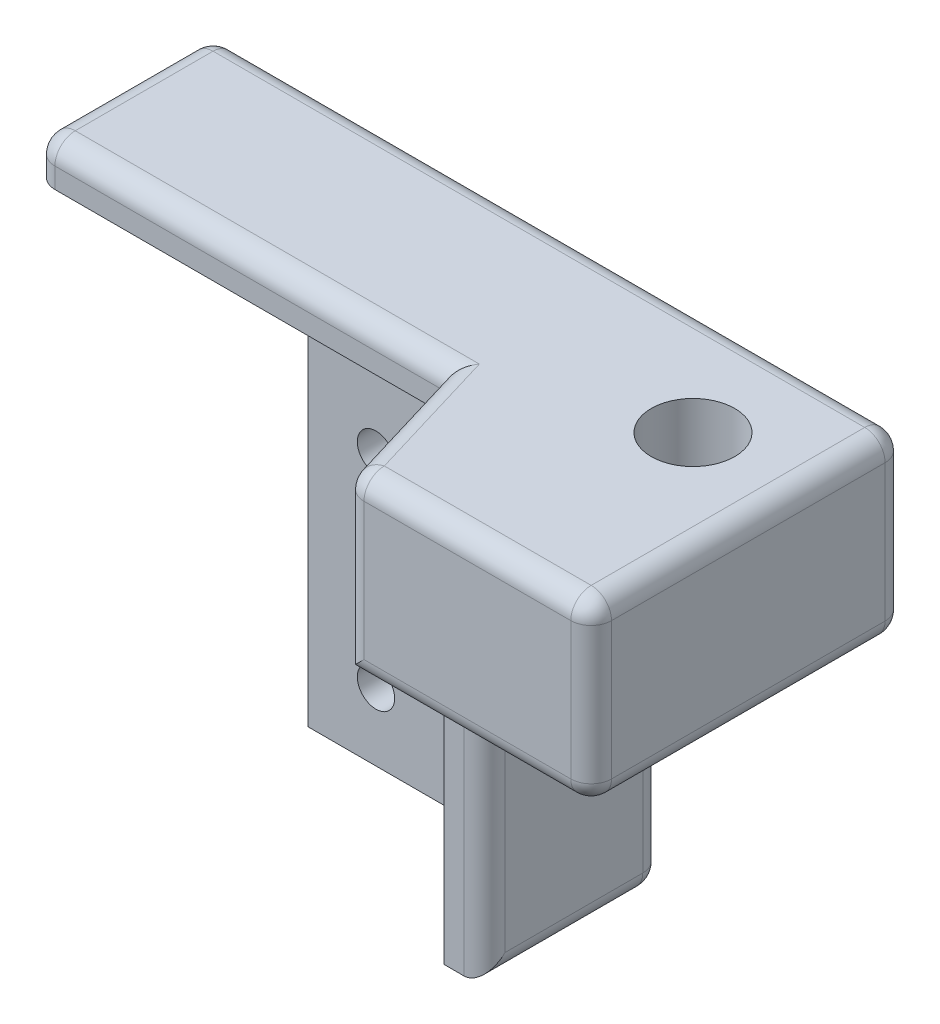
from build123d import *

# Parameters (mm, degrees)
SKETCH1_W                            = 102
SKETCH1_H                            = 26.3
SKETCH1_R                            = 6.15
BASE_DEPTH                           = 20.2
BACKSIDE_SURFACE_1_REACH             = 109.255
SKETCH2_W                            = 60.3
SKETCH2_H                            = 20.3
BACKSIDE_SURFACE_1_DIRECTION_2_DEPTH = 108.255442752
SKETCH4_W                            = 6
SKETCH4_H                            = 26.3
LEG_DEPTH                            = 50
SKETCH5_W                            = 26.3
SKETCH5_H                            = 6
ROOF_DEPTH                           = 102
SKETCH6_R                            = 6.15
HOLE_FOR_LINEAR_ROD_DEPTH            = 26.2
SKETCH9_W                            = 35.7
SKETCH9_H                            = 20
BOSS_EXTRUDE5_DEPTH                  = 26.2
SKETCH7_W                            = 40.3
SKETCH7_H                            = 50
BACKSIDE_SURFACE_2_DEPTH             = 6
BOLT_HOLES_REACH                     = 124.669
SKETCH3_R                            = 2.75
CHAMFER1_SIZE                        = 6
CHAMFER1_SIZE_2                      = 20
FILLET1_R                            = 3


with BuildPart() as part:
    # Sketch1 → base (new body)
    with BuildSketch(Plane(origin=(0, 0, 0), x_dir=(1, 0, 0), z_dir=(0, 1, 0))):
        with Locations((51, 13.15)):
            Rectangle(SKETCH1_W, SKETCH1_H)
        with Locations(Location((87, 10, 0), (0, 0, 270))):
            Circle(SKETCH1_R, mode=Mode.SUBTRACT)
    extrude(amount=BASE_DEPTH)

    # Sketch2 → backside surface 1 (cut, up to next)
    with BuildSketch(Plane(origin=(0, 20.2, 0), x_dir=(1, 0, 0), z_dir=(0, 1, 0)), mode=Mode.PRIVATE) as backside_surface_1_sk1:
        with Locations((30.15, 10.15)):
            Rectangle(SKETCH2_W, SKETCH2_H)
    backside_surface_1_tool1 = extrude(backside_surface_1_sk1.sketch, amount=-BACKSIDE_SURFACE_1_REACH, mode=Mode.PRIVATE) & part.part
    add(backside_surface_1_tool1.solids().sort_by_distance((30.15, 20.2, -10.15))[0], mode=Mode.SUBTRACT)

    # Sketch2 → backside surface 1 direction 2 (cut)
    with BuildSketch(Plane(origin=(0, 20.2, 0), x_dir=(1, 0, 0), z_dir=(0, 1, 0))):
        with Locations((30.15, 10.15)):
            Rectangle(SKETCH2_W, SKETCH2_H)
    extrude(amount=BACKSIDE_SURFACE_1_DIRECTION_2_DEPTH, mode=Mode.SUBTRACT)

    # Sketch4 → leg (add)
    with BuildSketch(Plane(origin=(0, 0, 0), x_dir=(1, 0, 0), z_dir=(0, 1, 0))):
        with Locations((63.3, 13.15)):
            Rectangle(SKETCH4_W, SKETCH4_H)
    extrude(amount=-LEG_DEPTH)

    # Sketch5 → roof (add)
    with BuildSketch(Plane.ZY):
        with Locations((-13.15, 23.2)):
            Rectangle(SKETCH5_W, SKETCH5_H)
    extrude(amount=-ROOF_DEPTH)

    # Sketch6 → hole for linear rod (cut)
    with BuildSketch(Plane.XZ):
        with Locations(Location((87, -10, 0), (0, 0, 90))):
            Circle(SKETCH6_R)
    extrude(amount=-HOLE_FOR_LINEAR_ROD_DEPTH, mode=Mode.SUBTRACT)

    # Sketch9 → Boss-Extrude5 (add)
    with BuildSketch(Plane(origin=(0, 26.2, 0), x_dir=(1, 0, 0), z_dir=(0, 1, 0))):
        with Locations((84.15, -10)):
            Rectangle(SKETCH9_W, SKETCH9_H)
    extrude(amount=-BOSS_EXTRUDE5_DEPTH)

    # Sketch7 → backside surface 2 (add)
    with BuildSketch(Plane.XY.offset(-26.3)):
        with Locations((40.15, -25)):
            Rectangle(SKETCH7_W, SKETCH7_H)
    extrude(amount=BACKSIDE_SURFACE_2_DEPTH)

    # Sketch3 → bolt holes (cut, up to next)
    with BuildSketch(Plane.XY.offset(-26.3), mode=Mode.PRIVATE) as bolt_holes_sk1:
        with Locations((12, 10)):
            Circle(SKETCH3_R)
    bolt_holes_tool1 = extrude(bolt_holes_sk1.sketch, amount=BOLT_HOLES_REACH, mode=Mode.PRIVATE) & part.part
    # Sketch3 → bolt holes (cut, up to next)
    with BuildSketch(Plane.XY.offset(-26.3), mode=Mode.PRIVATE) as bolt_holes_sk2:
        with Locations(Location((52, 10, 0), (0, 0, 180))):
            Circle(SKETCH3_R)
    bolt_holes_tool2 = extrude(bolt_holes_sk2.sketch, amount=BOLT_HOLES_REACH, mode=Mode.PRIVATE) & part.part
    # Sketch3 → bolt holes (cut, up to next)
    with BuildSketch(Plane.XY.offset(-26.3), mode=Mode.PRIVATE) as bolt_holes_sk3:
        with Locations((30, -10)):
            Circle(SKETCH3_R)
    bolt_holes_tool3 = extrude(bolt_holes_sk3.sketch, amount=BOLT_HOLES_REACH, mode=Mode.PRIVATE) & part.part
    # Sketch3 → bolt holes (cut, up to next)
    with BuildSketch(Plane.XY.offset(-26.3), mode=Mode.PRIVATE) as bolt_holes_sk4:
        with Locations((30, -40)):
            Circle(SKETCH3_R)
    bolt_holes_tool4 = extrude(bolt_holes_sk4.sketch, amount=BOLT_HOLES_REACH, mode=Mode.PRIVATE) & part.part
    # Sketch3 → bolt holes (cut, up to next)
    with BuildSketch(Plane.XY.offset(-26.3), mode=Mode.PRIVATE) as bolt_holes_sk5:
        with Locations(Location((50, -40, 0), (0, 0, 180))):
            Circle(SKETCH3_R)
    bolt_holes_tool5 = extrude(bolt_holes_sk5.sketch, amount=BOLT_HOLES_REACH, mode=Mode.PRIVATE) & part.part
    # Sketch3 → bolt holes (cut, up to next)
    with BuildSketch(Plane.XY.offset(-26.3), mode=Mode.PRIVATE) as bolt_holes_sk6:
        with Locations(Location((50, -10, 0), (0, 0, 180))):
            Circle(SKETCH3_R)
    bolt_holes_tool6 = extrude(bolt_holes_sk6.sketch, amount=BOLT_HOLES_REACH, mode=Mode.PRIVATE) & part.part
    add(bolt_holes_tool1.solids().sort_by_distance((12, 10, -26.3))[0], mode=Mode.SUBTRACT)
    add(bolt_holes_tool2.solids().sort_by_distance((52, 10, -26.3))[0], mode=Mode.SUBTRACT)
    add(bolt_holes_tool3.solids().sort_by_distance((30, -10, -26.3))[0], mode=Mode.SUBTRACT)
    add(bolt_holes_tool4.solids().sort_by_distance((30, -40, -26.3))[0], mode=Mode.SUBTRACT)
    add(bolt_holes_tool5.solids().sort_by_distance((50, -40, -26.3))[0], mode=Mode.SUBTRACT)
    add(bolt_holes_tool6.solids().sort_by_distance((50, -10, -26.3))[0], mode=Mode.SUBTRACT)

    # Chamfer1
    # the kernel refuses this chamfer: 20, 6 mm, written as the material it adds along each edge
    with BuildSketch(Plane(origin=(66.3, 26.2, 0), x_dir=(-0.9925205348140392, 0, -0.12207779475585914), z_dir=(0, -1, 0))) as chamfer1_piece_1:
        Polygon((CHAMFER1_SIZE * 0.992520534814, -CHAMFER1_SIZE * 0.122077794756), (-CHAMFER1_SIZE_2 * 0.122077794756, -CHAMFER1_SIZE_2 * 0.992520534814), (0, 0), align=None)
    extrude(amount=26.2)

    # Fillet1
    fillet1_edges = [part.edges().sort_by_distance(p)[0] for p in [
        (30.15, 26.2, 0),
        (63.3, 0, 0),
        (63.3, 26.2, 10),
        (43.15, -50, -26.3),
        (66.3, -50, -13.15),
        (66.3, -25, -26.3),
        (66.3, -25, 0),
        (66.3, 0, -13.15),
        (84.15, 0, -26.3),
        (102, 0, -3.15),
        (51, 26.2, -26.3),
        (0, 23.2, 0),
        (0, 26.2, -13.15),
        (102, 26.2, -3.15),
        (84.15, 26.2, 20),
        (84.15, 0, 20),
        (102, 13.1, 20),
        (66.3, 13.1, 20),
        (0, 13.1, -26.3),
        (102, 13.1, -26.3),
        (10, 0, -26.3),
        (20, -25, -26.3),
    ]]
    fillet(fillet1_edges, radius=FILLET1_R)


solid = part.part
